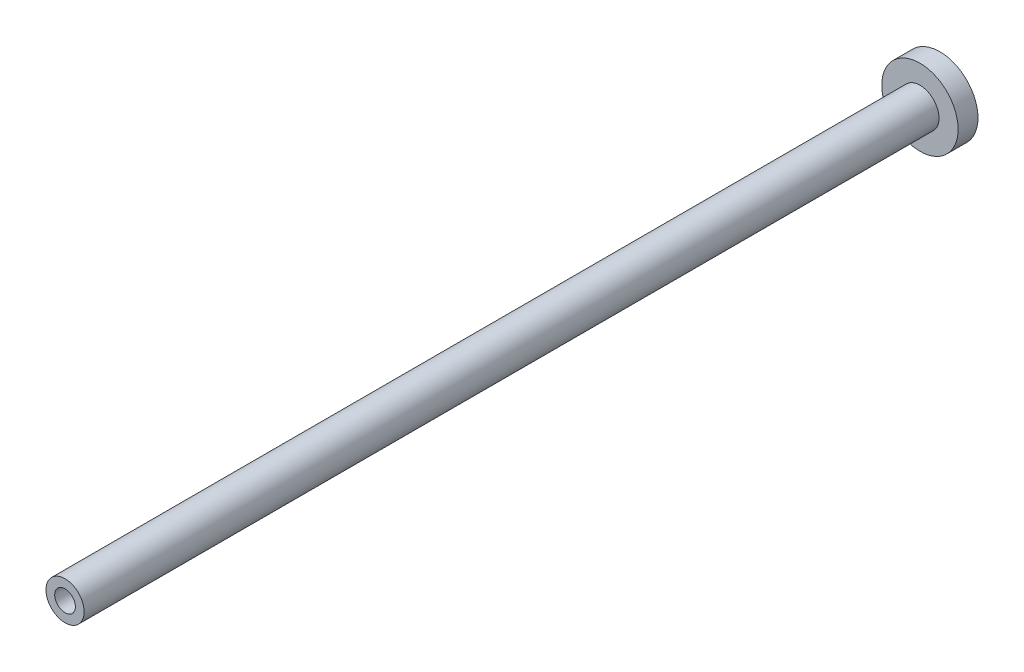
from build123d import *

# Parameters (mm, degrees)
SKETCH1_R           = 4.8
BOSS_EXTRUDE1_DEPTH = 110
SKETCH6_R           = 1.25
BOSS_EXTRUDE2_DEPTH = 2.5
SKETCH7_R           = 1.3
CUT_EXTRUDE1_DEPTH  = 2.5
SKETCH9_OUTSIDE_W   = 34.264
SKETCH9_OUTSIDE_H   = 34.264
SKETCH9_OUTSIDE_R   = 2.4
CUT_EXTRUDE2_DEPTH  = 107.5


with BuildPart() as part:
    # Sketch1 → Boss-Extrude1 (new body)
    with BuildSketch(Plane.XY):
        Circle(SKETCH1_R)
    extrude(amount=BOSS_EXTRUDE1_DEPTH)

    # Sketch6 → Boss-Extrude2 (add)
    with BuildSketch(Plane(origin=(0, 0, 0), x_dir=(-1, 0, 0), z_dir=(0, 0, -1))):
        Circle(SKETCH6_R)
    extrude(amount=BOSS_EXTRUDE2_DEPTH)

    # Sketch7 → Cut-Extrude1 (cut)
    with BuildSketch(Plane.XY.offset(110)):
        Circle(SKETCH7_R)
    extrude(amount=-CUT_EXTRUDE1_DEPTH, mode=Mode.SUBTRACT)

    # Sketch9 outside → Cut-Extrude2 (cut)
    with BuildSketch(Plane.XY.offset(110)):
        Rectangle(SKETCH9_OUTSIDE_W, SKETCH9_OUTSIDE_H)
        Circle(SKETCH9_OUTSIDE_R, mode=Mode.SUBTRACT)
    extrude(amount=-CUT_EXTRUDE2_DEPTH, mode=Mode.SUBTRACT)


solid = part.part
